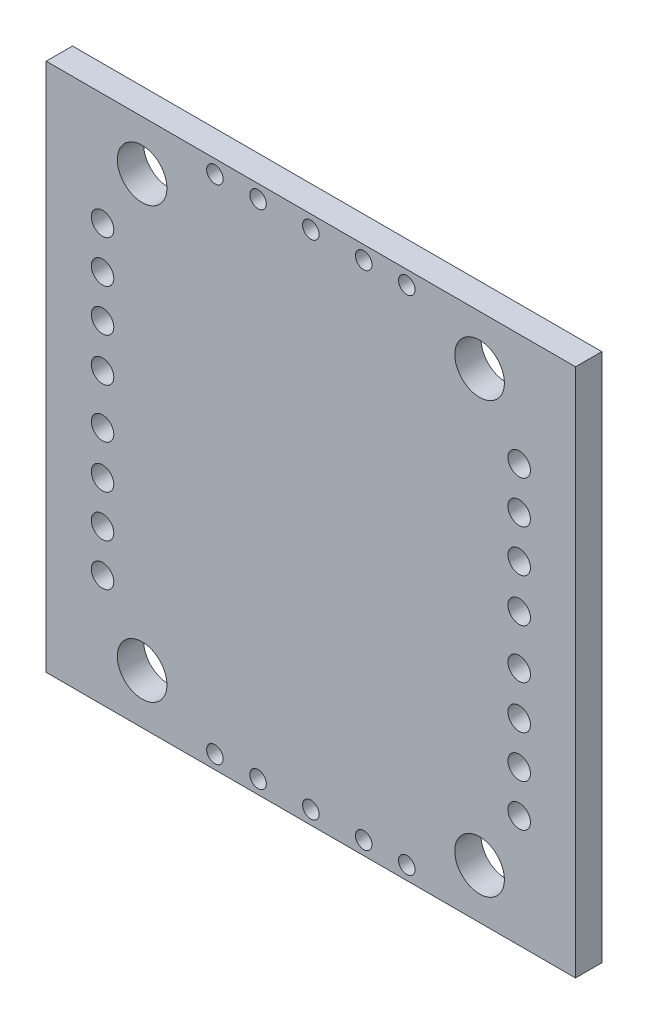
from build123d import *

# Parameters (mm, degrees)
SKETCH_3_W      = 32
SKETCH_3_H      = 32
SKETCH_3_R      = 1.5
SKETCH_3_R_2    = 0.68
SKETCH_3_R_3    = 0.5
EXTRUDE_5_DEPTH = 1.59


with BuildPart() as part:
    # 草图3 → 凸台-拉伸5 (new body)
    with BuildSketch(Plane.XY):
        Rectangle(SKETCH_3_W, SKETCH_3_H)
        with Locations((-10.2, 13)):
            Circle(SKETCH_3_R, mode=Mode.SUBTRACT)
        with Locations((10.2, 13)):
            Circle(SKETCH_3_R, mode=Mode.SUBTRACT)
        with Locations((10.2, -13)):
            Circle(SKETCH_3_R, mode=Mode.SUBTRACT)
        with Locations((-10.2, -13)):
            Circle(SKETCH_3_R, mode=Mode.SUBTRACT)
        with Locations((-12.594133286, 9.217216134)):
            Circle(SKETCH_3_R_2, mode=Mode.SUBTRACT)
        with Locations((-12.594133286, 6.664068101)):
            Circle(SKETCH_3_R_2, mode=Mode.SUBTRACT)
        with Locations((-12.594133286, 4.110920068)):
            Circle(SKETCH_3_R_2, mode=Mode.SUBTRACT)
        with Locations((-12.594133286, 1.492306701)):
            Circle(SKETCH_3_R_2, mode=Mode.SUBTRACT)
        with Locations((-12.594133286, -1.492306701)):
            Circle(SKETCH_3_R_2, mode=Mode.SUBTRACT)
        with Locations((-12.594133286, -4.110920068)):
            Circle(SKETCH_3_R_2, mode=Mode.SUBTRACT)
        with Locations((-12.594133286, -6.664068101)):
            Circle(SKETCH_3_R_2, mode=Mode.SUBTRACT)
        with Locations((-12.594133286, -9.217216134)):
            Circle(SKETCH_3_R_2, mode=Mode.SUBTRACT)
        with Locations((12.594133286, -9.217216134)):
            Circle(SKETCH_3_R_2, mode=Mode.SUBTRACT)
        with Locations((12.594133286, -6.664068101)):
            Circle(SKETCH_3_R_2, mode=Mode.SUBTRACT)
        with Locations((12.594133286, -4.110920068)):
            Circle(SKETCH_3_R_2, mode=Mode.SUBTRACT)
        with Locations((12.594133286, -1.492306701)):
            Circle(SKETCH_3_R_2, mode=Mode.SUBTRACT)
        with Locations((12.594133286, 1.492306701)):
            Circle(SKETCH_3_R_2, mode=Mode.SUBTRACT)
        with Locations((12.594133286, 4.110920068)):
            Circle(SKETCH_3_R_2, mode=Mode.SUBTRACT)
        with Locations((12.594133286, 6.664068101)):
            Circle(SKETCH_3_R_2, mode=Mode.SUBTRACT)
        with Locations((12.594133286, 9.217216134)):
            Circle(SKETCH_3_R_2, mode=Mode.SUBTRACT)
        with Locations((-5.8, 15.18)):
            Circle(SKETCH_3_R_3, mode=Mode.SUBTRACT)
        with Locations((0, 15.18)):
            Circle(SKETCH_3_R_3, mode=Mode.SUBTRACT)
        with Locations((-3.193886251, 15.18)):
            Circle(SKETCH_3_R_3, mode=Mode.SUBTRACT)
        with Locations((3.193886251, 15.18)):
            Circle(SKETCH_3_R_3, mode=Mode.SUBTRACT)
        with Locations((5.8, 15.18)):
            Circle(SKETCH_3_R_3, mode=Mode.SUBTRACT)
        with Locations((5.8, -15.18)):
            Circle(SKETCH_3_R_3, mode=Mode.SUBTRACT)
        with Locations((3.193886251, -15.18)):
            Circle(SKETCH_3_R_3, mode=Mode.SUBTRACT)
        with Locations((0, -15.18)):
            Circle(SKETCH_3_R_3, mode=Mode.SUBTRACT)
        with Locations((-3.193886251, -15.18)):
            Circle(SKETCH_3_R_3, mode=Mode.SUBTRACT)
        with Locations((-5.8, -15.18)):
            Circle(SKETCH_3_R_3, mode=Mode.SUBTRACT)
    extrude(amount=EXTRUDE_5_DEPTH)


solid = part.part
